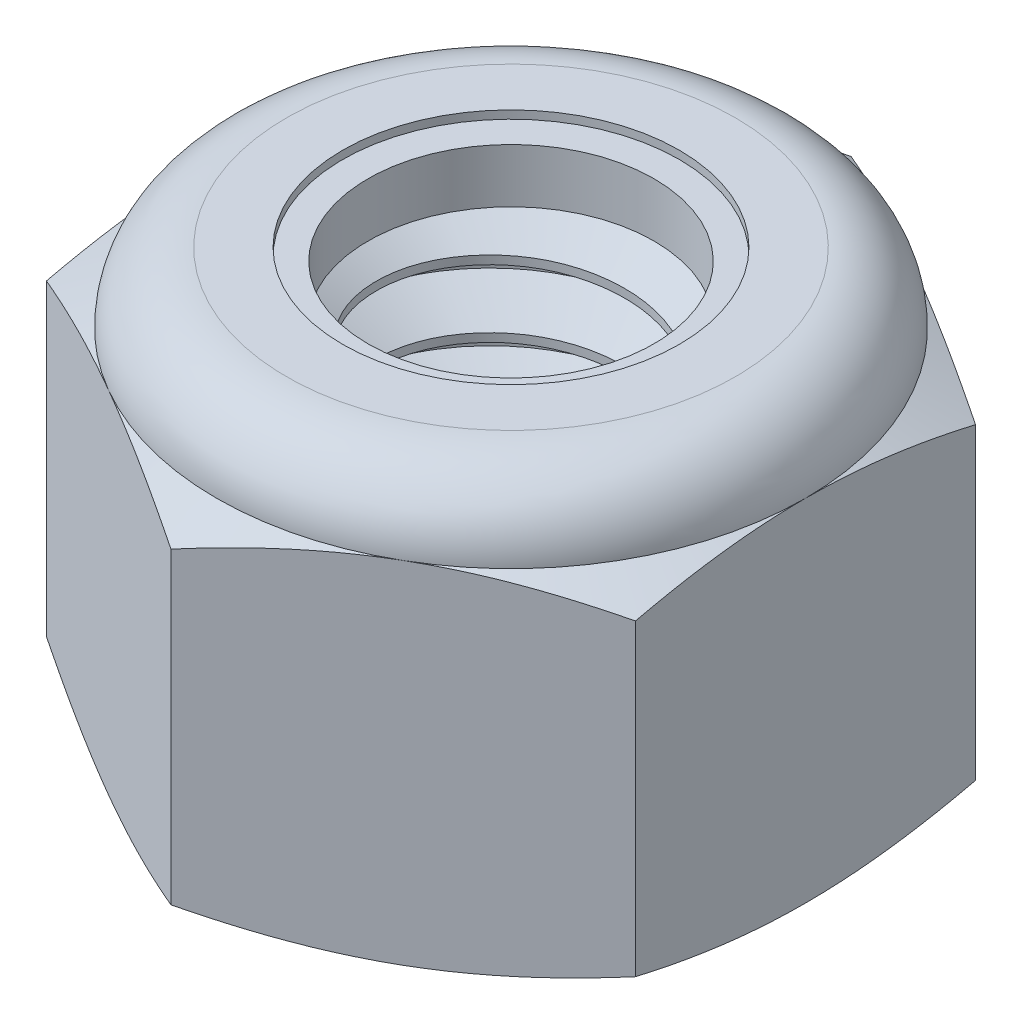
from build123d import *

# Parameters (mm, degrees)
SKETCH13_R       = 3.175
EXTRUDE1_DEPTH   = 7.9375
SKETCH2_W        = 3.175
SKETCH2_H        = 6.614583333
CUT_SWEEP1_PITCH = 1.27
SKETCH12_W       = 3.4925
SKETCH12_H       = 6.614583333


with BuildPart() as part:
    # Sketch13 → Extrude1 (new body)
    with BuildSketch(Plane(origin=(0, 0, 0), x_dir=(1, 0, 0), z_dir=(0, 1, 0))):
        Polygon((0, 6.415804866), (-5.55625, 3.207902433), (-5.55625, -3.207902433), (0, -6.415804866), (5.55625, -3.207902433), (5.55625, 3.207902433), align=None)
        with Locations(Location((0, 0, 0), (0, 0, 270))):
            Circle(SKETCH13_R, mode=Mode.SUBTRACT)
    extrude(amount=EXTRUDE1_DEPTH)

    # Sketch5 → Cut-Revolve3 (revolve, cut)
    with BuildSketch(Plane(origin=(0, 0, 0), x_dir=(0, 0, -1), z_dir=(1, 0, 0))):
        with BuildLine():
            Line((0, 0), (5.55625, 0))
            Line((5.55625, 0), (6.415804866, 0.400817017))
            Line((6.415804866, 0.400817017), (6.415804866, 6.213766317))
            Line((6.415804866, 6.213766317), (5.55625, 6.614583333))
            ThreePointArc((5.55625, 6.614583333), (5.168776679, 7.550026679), (4.233333333, 7.9375))
            Line((4.233333333, 7.9375), (4.233333333, 9.2075))
            Line((4.233333333, 9.2075), (7.685804866, 9.2075))
            Line((7.685804866, 9.2075), (7.685804866, -1.27))
            Line((7.685804866, -1.27), (0, -1.27))
            Line((0, -1.27), (0, 0))
        make_face()
    revolve(axis=Axis((0, 0, 0), (0, 1, 0)), mode=Mode.SUBTRACT)

    # Sketch6 → Cut-Revolve4 (revolve, cut)
    with BuildSketch(Plane(origin=(0, 0, 0), x_dir=(0, 0, -1), z_dir=(1, 0, 0)), mode=Mode.PRIVATE) as cut_revolve4_sk:
        with BuildLine():
            Line((0, 6.614583333), (5.40385, 6.614583333))
            ThreePointArc((5.40385, 6.614583333), (5.061013606, 7.442263606), (4.233333333, 7.7851))
            Line((4.233333333, 7.7851), (2.116666667, 7.7851))
            Line((2.116666667, 7.7851), (2.116666667, 9.2075))
            Line((2.116666667, 9.2075), (0, 9.2075))
            Line((0, 9.2075), (0, 6.614583333))
        make_face()
    revolve(cut_revolve4_sk.sketch.rotate(Axis((0, 9.2075, 0), (0, -1, 0)), 180), axis=Axis((0, 9.2075, 0), (0, -1, 0)), mode=Mode.SUBTRACT)

    # Sketch4 → Cut-Revolve2 (revolve, cut)
    with BuildSketch(Plane(origin=(0, 0, 0), x_dir=(0, 0, -1), z_dir=(1, 0, 0))):
        Polygon((0, 6.614583333), (3.4925, 6.614583333), (0, 4.986003837), align=None)
        Polygon((0, 1.628579496), (3.4925, 0), (0, 0), align=None)
    revolve(axis=Axis((0, 0, 0), (0, 1, 0)), mode=Mode.SUBTRACT)

    # Sketch12 → Revolve4 (revolve)
    with BuildSketch(Plane(origin=(0, 0, 0), x_dir=(0, 0, -1), z_dir=(1, 0, 0)), mode=Mode.PRIVATE) as revolve4_sk:
        with Locations((1.74625, 3.307291667)):
            Rectangle(SKETCH12_W, SKETCH12_H)
    revolve(revolve4_sk.sketch.rotate(Axis((0, 0, 0), (0, 1, 0)), 12.180611304), axis=Axis((0, 0, 0), (0, 1, 0)))


with BuildPart() as body_2:
    # Sketch7 → Revolve2 (revolve)
    with BuildSketch(Plane(origin=(0, 0, 0), x_dir=(0, 0, -1), z_dir=(1, 0, 0))):
        with BuildLine():
            Line((2.69875, 6.690783333), (5.324993778, 6.690783333))
            ThreePointArc((5.324993778, 6.690783333), (4.979705237, 7.4148695), (4.233333333, 7.7089))
            Line((4.233333333, 7.7089), (2.69875, 7.7089))
            Line((2.69875, 7.7089), (2.69875, 6.690783333))
        make_face()
    revolve(axis=Axis((0, 6.690783333, 0), (0, 1, 0)))


with BuildPart() as body_3:
    # Sketch2 → Revolve1 (revolve)
    with BuildSketch(Plane(origin=(0, 0, 0), x_dir=(0, 0, -1), z_dir=(1, 0, 0))):
        with Locations((1.5875, 3.307291667)):
            Rectangle(SKETCH2_W, SKETCH2_H)
    revolve(axis=Axis((0, -3.175, 0), (0, 1, 0)))

    # Cut-Sweep1: the profile of Sketch9 screwed along a right-hand helix of 7.25 turns, 8 arcs to a turn; built about Z, then put on its axis
    cut_sweep1_z = Axis((0, 0, 0), (0, 0, 1))
    cut_sweep1_corners = [(3.312481533, 0, 0.079375), (3.243740766, 0, -1.1509375), (2.350110803, 0, -0.635), (2.350110803, 0, -0.47625)]
    with BuildLine(mode=Mode.PRIVATE) as cut_sweep1_profile:
        Line(cut_sweep1_corners[0], cut_sweep1_corners[1])
        Line(cut_sweep1_corners[1], cut_sweep1_corners[2])
        Line(cut_sweep1_corners[2], cut_sweep1_corners[3])
        Line(cut_sweep1_corners[3], cut_sweep1_corners[0])
    cut_sweep1_cap = Face(cut_sweep1_profile.wire())
    cut_sweep1_turn_angles = [0, 22.5, 45, 67.5, 90, 112.5, 135, 157.5, 180, 202.5, 225, 247.5, 270, 292.5, 315, 337.5, 360]
    cut_sweep1_turn_weights = [1, 0.9238795325112867, 1, 0.9238795325112867, 1, 0.9238795325112867, 1, 0.9238795325112867, 1, 0.9238795325112867, 1, 0.9238795325112867, 1, 0.9238795325112867, 1, 0.9238795325112867, 1]
    cut_sweep1_turn_rails = [Edge.make_bspline([Vector(p[0], p[1], 0).rotate(cut_sweep1_z, cut_sweep1_turn_angles[k]) / cut_sweep1_turn_weights[k] + Vector(0, 0, p[2] + CUT_SWEEP1_PITCH * cut_sweep1_turn_angles[k] / 360) for k in range(17)], [0, 0, 0, 1, 1, 2, 2, 3, 3, 4, 4, 5, 5, 6, 6, 7, 7, 8, 8, 8], 2, cut_sweep1_turn_weights) for p in cut_sweep1_corners]
    cut_sweep1_turn_sides = [Face.make_surface_from_curves(cut_sweep1_turn_rails[p[0]], cut_sweep1_turn_rails[p[1]]) for p in [(0, 1), (1, 2), (2, 3), (3, 0)]]
    cut_sweep1_last_angles = [2520, 2542.5, 2565, 2587.5, 2610]
    cut_sweep1_last_weights = [1, 0.9238795325112867, 1, 0.9238795325112564, 1]
    cut_sweep1_last_rails = [Edge.make_bspline([Vector(p[0], p[1], 0).rotate(cut_sweep1_z, cut_sweep1_last_angles[k]) / cut_sweep1_last_weights[k] + Vector(0, 0, p[2] + CUT_SWEEP1_PITCH * cut_sweep1_last_angles[k] / 360) for k in range(5)], [0, 0, 0, 1, 1, 2, 2, 2], 2, cut_sweep1_last_weights) for p in cut_sweep1_corners]
    cut_sweep1_last_sides = [Face.make_surface_from_curves(cut_sweep1_last_rails[p[0]], cut_sweep1_last_rails[p[1]]) for p in [(0, 1), (1, 2), (2, 3), (3, 0)]]
    cut_sweep1 = Plane(origin=(0, 6.614583333, 0), x_dir=(0, 0, -1), z_dir=(0, -1, 0)) * Solid(Shell([*[p.moved(Location((0, 0, CUT_SWEEP1_PITCH * i))) for i in range(7) for p in cut_sweep1_turn_sides], *cut_sweep1_last_sides, cut_sweep1_cap, cut_sweep1_cap.rotate(cut_sweep1_z, 2610).moved(Location((0, 0, CUT_SWEEP1_PITCH * 2610 / 360)))]))
    add(cut_sweep1, mode=Mode.SUBTRACT)

    # Sketch11 → Revolve3 (revolve)
    with BuildSketch(Plane(origin=(0, 0, 0), x_dir=(0, 0, -1), z_dir=(1, 0, 0))):
        Polygon((0, 0), (3.4925, 0), (0, 1.628579496), align=None)
    revolve(axis=Axis((0, 7.9375, 0), (0, -1, 0)))


with BuildPart() as part_1:
    add(part.part)

    # Combine1: cut body 3
    add(body_3.part, mode=Mode.SUBTRACT)


solid = Compound([body_2.part, part_1.part])
